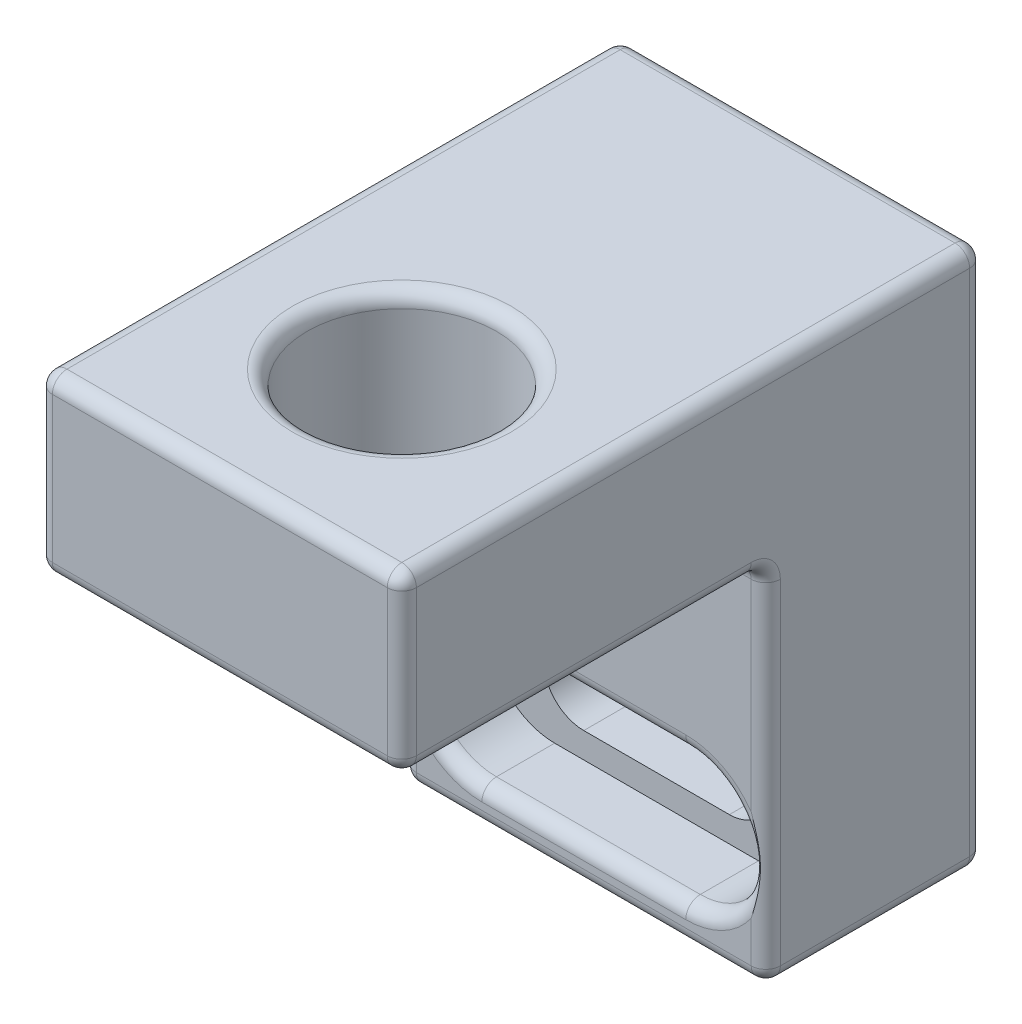
from build123d import *

# Parameters (mm, degrees)
CROQUIS1_W              = 25
CROQUIS1_H              = 37
SALIENTE_EXTRUIR1_DEPTH = 20
CROQUIS2_W              = 25
CROQUIS2_H              = 12
SALIENTE_EXTRUIR2_DEPTH = 20
CORTAR_EXTRUIR1_DEPTH   = 20
CORTAR_EXTRUIR2_DEPTH   = 10
CROQUIS5_R              = 6.5
CORTAR_EXTRUIR3_DEPTH   = 18
CROQUIS6_W              = 5
CROQUIS6_H              = 25
CORTAR_EXTRUIR4_DEPTH   = 28
REDONDEO1_R             = 1


with BuildPart() as part:
    # Croquis1 → Saliente-Extruir1 (new body)
    with BuildSketch(Plane.XY):
        Rectangle(CROQUIS1_W, CROQUIS1_H)
    extrude(amount=SALIENTE_EXTRUIR1_DEPTH)

    # Croquis2 → Saliente-Extruir2 (add)
    with BuildSketch(Plane.XY.offset(20)):
        with Locations((0, 12.5)):
            Rectangle(CROQUIS2_W, CROQUIS2_H)
    extrude(amount=SALIENTE_EXTRUIR2_DEPTH)

    # Croquis3 → Cortar-Extruir1 (cut)
    with BuildSketch(Plane.XY.offset(20)):
        with BuildLine():
            Line((-5, -8.75), (5, -8.75))
            ThreePointArc((5, -8.75), (7.75, -11.5), (5, -14.25))
            Line((5, -14.25), (-5, -14.25))
            ThreePointArc((-5, -14.25), (-7.75, -11.5), (-5, -8.75))
        make_face()
    extrude(amount=-CORTAR_EXTRUIR1_DEPTH, mode=Mode.SUBTRACT)

    # Croquis4 → Cortar-Extruir2 (cut)
    with BuildSketch(Plane.XY.offset(20)):
        with BuildLine():
            Line((-7, -7), (7, -7))
            ThreePointArc((7, -7), (11.5, -11.5), (7, -16))
            Line((7, -16), (-7, -16))
            ThreePointArc((-7, -16), (-11.5, -11.5), (-7, -7))
        make_face()
    extrude(amount=-CORTAR_EXTRUIR2_DEPTH, mode=Mode.SUBTRACT)

    # Croquis5 → Cortar-Extruir3 (cut)
    with BuildSketch(Plane(origin=(0, 18.5, 0), x_dir=(1, 0, 0), z_dir=(0, 1, 0))):
        with Locations(Location((0, -27.5, 0), (0, 0, 180))):
            Circle(CROQUIS5_R)
    extrude(amount=-CORTAR_EXTRUIR3_DEPTH, mode=Mode.SUBTRACT)

    # Croquis6 → Cortar-Extruir4 (cut)
    with BuildSketch(Plane(origin=(12.5, 0, 0), x_dir=(0, 0, -1), z_dir=(1, 0, 0))):
        with Locations((-17.5, -6)):
            Rectangle(CROQUIS6_W, CROQUIS6_H)
    extrude(amount=-CORTAR_EXTRUIR4_DEPTH, mode=Mode.SUBTRACT)

    # Redondeo1
    # the kernel refuses this fillet: 1 mm, written as the material it adds along each edge
    with BuildSketch(Plane(origin=(12.5, 6.5, 15), x_dir=(0, 0, 1), z_dir=(-1, 0, 0))) as redondeo1_piece_1:
        with BuildLine():
            CenterArc((REDONDEO1_R, -REDONDEO1_R), REDONDEO1_R, 90, 90)
            Line((0, -REDONDEO1_R), (0, 0))
            Line((0, 0), (REDONDEO1_R, 0))
        make_face()
    extrude(amount=25)
    # the kernel refuses this fillet: 1 mm, written as the material it takes off along each edge
    with BuildSketch(Plane(origin=(-11.5, 17.5, 39), x_dir=(0, 0, 1), z_dir=(0, 1, 0))) as redondeo1_2_piece_1_section:
        Polygon((0, 0), (REDONDEO1_R, 0), (REDONDEO1_R, -REDONDEO1_R), (0, -REDONDEO1_R), align=None)
    redondeo1_2_piece_1 = extrude(amount=REDONDEO1_R, mode=Mode.PRIVATE)
    redondeo1_2_piece_1 = redondeo1_2_piece_1 - Plane(origin=(-11.5, 17.5, 39), x_dir=(0.7071067811865475, 0, -0.7071067811865475), z_dir=(0, 1, 0)) * Sphere(REDONDEO1_R, mode=Mode.PRIVATE)
    add(redondeo1_2_piece_1, mode=Mode.SUBTRACT)
    with BuildSketch(Plane(origin=(11.5, 17.5, 39), x_dir=(1, 0, 0), z_dir=(0, 1, 0))) as redondeo1_2_piece_2_section:
        Polygon((0, 0), (REDONDEO1_R, 0), (REDONDEO1_R, -REDONDEO1_R), (0, -REDONDEO1_R), align=None)
    redondeo1_2_piece_2 = extrude(amount=REDONDEO1_R, mode=Mode.PRIVATE)
    redondeo1_2_piece_2 = redondeo1_2_piece_2 - Plane(origin=(11.5, 17.5, 39), x_dir=(-0.7071067811865475, 0, -0.7071067811865475), z_dir=(0, 1, 0)) * Sphere(REDONDEO1_R, mode=Mode.PRIVATE)
    add(redondeo1_2_piece_2, mode=Mode.SUBTRACT)
    with BuildSketch(Plane(origin=(11.5, 17.5, 1), x_dir=(1, 0, 0), z_dir=(0, 1, 0))) as redondeo1_2_piece_3_section:
        Polygon((0, 0), (REDONDEO1_R, 0), (REDONDEO1_R, REDONDEO1_R), (0, REDONDEO1_R), align=None)
    redondeo1_2_piece_3 = extrude(amount=REDONDEO1_R, mode=Mode.PRIVATE)
    redondeo1_2_piece_3 = redondeo1_2_piece_3 - Plane(origin=(11.5, 17.5, 1), x_dir=(-0.7071067811865475, 0, 0.7071067811865475), z_dir=(0, 1, 0)) * Sphere(REDONDEO1_R, mode=Mode.PRIVATE)
    add(redondeo1_2_piece_3, mode=Mode.SUBTRACT)
    with BuildSketch(Plane(origin=(-11.5, 17.5, 1), x_dir=(0, 0, -1), z_dir=(0, 1, 0))) as redondeo1_2_piece_4_section:
        Polygon((0, 0), (REDONDEO1_R, 0), (REDONDEO1_R, REDONDEO1_R), (0, REDONDEO1_R), align=None)
    redondeo1_2_piece_4 = extrude(amount=REDONDEO1_R, mode=Mode.PRIVATE)
    redondeo1_2_piece_4 = redondeo1_2_piece_4 - Plane(origin=(-11.5, 17.5, 1), x_dir=(0.7071067811865475, 0, 0.7071067811865475), z_dir=(0, 1, 0)) * Sphere(REDONDEO1_R, mode=Mode.PRIVATE)
    add(redondeo1_2_piece_4, mode=Mode.SUBTRACT)
    with BuildSketch(Plane(origin=(11.5, -17.5, 1), x_dir=(0, 0, -1), z_dir=(1, 0, 0))) as redondeo1_2_piece_5_section:
        Polygon((0, 0), (REDONDEO1_R, 0), (REDONDEO1_R, -REDONDEO1_R), (0, -REDONDEO1_R), align=None)
    redondeo1_2_piece_5 = extrude(amount=REDONDEO1_R, mode=Mode.PRIVATE)
    redondeo1_2_piece_5 = redondeo1_2_piece_5 - Plane(origin=(11.5, -17.5, 1), x_dir=(0, 0.7071067811865475, 0.7071067811865475), z_dir=(1, 0, 0)) * Sphere(REDONDEO1_R, mode=Mode.PRIVATE)
    add(redondeo1_2_piece_5, mode=Mode.SUBTRACT)
    with BuildSketch(Plane(origin=(-11.5, -17.5, 1), x_dir=(-1, 0, 0), z_dir=(0, 0, -1))) as redondeo1_2_piece_6_section:
        Polygon((0, 0), (REDONDEO1_R, 0), (REDONDEO1_R, -REDONDEO1_R), (0, -REDONDEO1_R), align=None)
    redondeo1_2_piece_6 = extrude(amount=REDONDEO1_R, mode=Mode.PRIVATE)
    redondeo1_2_piece_6 = redondeo1_2_piece_6 - Plane(origin=(-11.5, -17.5, 1), x_dir=(0.7071067811865474, 0.7071067811865477, 0), z_dir=(0, 0, -1)) * Sphere(REDONDEO1_R, mode=Mode.PRIVATE)
    add(redondeo1_2_piece_6, mode=Mode.SUBTRACT)
    with BuildSketch(Plane(origin=(-12.5, 4, 40), x_dir=(1, 0, 0), z_dir=(0, 1, 0))) as redondeo1_2_piece_7:
        with BuildLine():
            CenterArc((REDONDEO1_R, REDONDEO1_R), REDONDEO1_R, 180, 90)
            Line((0, REDONDEO1_R), (0, 0))
            Line((0, 0), (REDONDEO1_R, 0))
        make_face()
    extrude(amount=13.5, mode=Mode.SUBTRACT)
    with BuildSketch(Plane(origin=(15, 6.5, 40), x_dir=(0, 1, 0), z_dir=(-1, 0, 0))) as redondeo1_2_piece_8:
        with BuildLine():
            CenterArc((REDONDEO1_R, REDONDEO1_R), REDONDEO1_R, 180, 90)
            Line((0, REDONDEO1_R), (0, 0))
            Line((0, 0), (REDONDEO1_R, 0))
        make_face()
    extrude(amount=30, mode=Mode.SUBTRACT)
    with BuildSketch(Plane(origin=(12.5, 17.5, 40), x_dir=(0, 0, -1), z_dir=(0, -1, 0))) as redondeo1_2_piece_9:
        with BuildLine():
            CenterArc((REDONDEO1_R, -REDONDEO1_R), REDONDEO1_R, 90, 90)
            Line((0, -REDONDEO1_R), (0, 0))
            Line((0, 0), (REDONDEO1_R, 0))
        make_face()
    extrude(amount=13.5, mode=Mode.SUBTRACT)
    with BuildSketch(Plane(origin=(-11.5, 18.5, 40), x_dir=(0, 0, -1), z_dir=(1, 0, 0)), Plane(origin=(11.5, 18.5, 0), x_dir=(0, 0, 1), z_dir=(-1, 0, 0))) as redondeo1_2_piece_10:
        with BuildLine():
            CenterArc((REDONDEO1_R, -REDONDEO1_R), REDONDEO1_R, 90, 90)
            Line((0, -REDONDEO1_R), (0, 0))
            Line((0, 0), (REDONDEO1_R, 0))
        make_face()
    extrude(amount=23, mode=Mode.SUBTRACT)
    with BuildSketch(Plane(origin=(12.5, -17.5, 0), x_dir=(0, 0, 1), z_dir=(0, 1, 0))) as redondeo1_2_piece_11:
        with BuildLine():
            CenterArc((REDONDEO1_R, -REDONDEO1_R), REDONDEO1_R, 90, 90)
            Line((0, -REDONDEO1_R), (0, 0))
            Line((0, 0), (REDONDEO1_R, 0))
        make_face()
    extrude(amount=35, mode=Mode.SUBTRACT)
    with BuildSketch(Plane(origin=(-11.5, -18.5, 0), x_dir=(0, 1, 0), z_dir=(1, 0, 0))) as redondeo1_2_piece_12:
        with BuildLine():
            CenterArc((REDONDEO1_R, REDONDEO1_R), REDONDEO1_R, 180, 90)
            Line((0, REDONDEO1_R), (0, 0))
            Line((0, 0), (REDONDEO1_R, 0))
        make_face()
    extrude(amount=23, mode=Mode.SUBTRACT)
    with BuildSketch(Plane(origin=(-12.5, 17.5, 0), x_dir=(1, 0, 0), z_dir=(0, -1, 0))) as redondeo1_2_piece_13:
        with BuildLine():
            CenterArc((REDONDEO1_R, REDONDEO1_R), REDONDEO1_R, 180, 90)
            Line((0, REDONDEO1_R), (0, 0))
            Line((0, 0), (REDONDEO1_R, 0))
        make_face()
    extrude(amount=35, mode=Mode.SUBTRACT)
    with BuildSketch(Plane(origin=(0, 6.5, 27.5), x_dir=(-1, 0, 0), z_dir=(0, 0, -1))) as redondeo1_2_piece_14:
        with BuildLine():
            CenterArc((6.5 + REDONDEO1_R, REDONDEO1_R), REDONDEO1_R, 180, 90)
            Line((6.5 + REDONDEO1_R, 0), (6.5, 0))
            Line((6.5, 0), (6.5, REDONDEO1_R))
        make_face()
    revolve(axis=Axis((0, 6.5, 27.5), (0, 1, 0)), mode=Mode.SUBTRACT)
    with BuildSketch(Plane(origin=(0, 18.5, 27.5), x_dir=(-1, 0, 0), z_dir=(0, 0, -1))) as redondeo1_2_piece_15:
        with BuildLine():
            CenterArc((6.5 + REDONDEO1_R, -REDONDEO1_R), REDONDEO1_R, 90, 90)
            Line((6.5, -REDONDEO1_R), (6.5, 0))
            Line((6.5, 0), (6.5 + REDONDEO1_R, 0))
        make_face()
    revolve(axis=Axis((0, 18.5, 27.5), (0, 1, 0)), mode=Mode.SUBTRACT)
    with BuildSketch(Plane(origin=(-12.5, 18.5, 1), x_dir=(1, 0, 0), z_dir=(0, 0, 1)), Plane(origin=(12.5, 18.5, 39), x_dir=(-1, 0, 0), z_dir=(0, 0, -1))) as redondeo1_2_piece_16:
        with BuildLine():
            CenterArc((REDONDEO1_R, -REDONDEO1_R), REDONDEO1_R, 90, 90)
            Line((0, -REDONDEO1_R), (0, 0))
            Line((0, 0), (REDONDEO1_R, 0))
        make_face()
    extrude(amount=38, mode=Mode.SUBTRACT)
    with BuildSketch(Plane(origin=(-7, -16, 15), x_dir=(0, -1, 0), z_dir=(1, 0, 0)), Plane(origin=(7, -7, 15), x_dir=(0, 1, 0), z_dir=(-1, 0, 0))) as redondeo1_2_piece_17:
        with BuildLine():
            CenterArc((REDONDEO1_R, REDONDEO1_R), REDONDEO1_R, 180, 90)
            Line((0, REDONDEO1_R), (0, 0))
            Line((0, 0), (REDONDEO1_R, 0))
        make_face()
    extrude(amount=14, mode=Mode.SUBTRACT)
    with BuildSketch(Plane(origin=(12.5, -18.5, 1), x_dir=(0, 1, 0), z_dir=(0, 0, 1))) as redondeo1_2_piece_18:
        with BuildLine():
            CenterArc((REDONDEO1_R, REDONDEO1_R), REDONDEO1_R, 180, 90)
            Line((0, REDONDEO1_R), (0, 0))
            Line((0, 0), (REDONDEO1_R, 0))
        make_face()
    extrude(amount=16.5, mode=Mode.SUBTRACT)
    with BuildSketch(Plane(origin=(-12.5, -18.5, 1), x_dir=(0, 1, 0), z_dir=(0, 0, 1))) as redondeo1_2_piece_19:
        with BuildLine():
            CenterArc((REDONDEO1_R, -REDONDEO1_R), REDONDEO1_R, 90, 90)
            Line((0, -REDONDEO1_R), (0, 0))
            Line((0, 0), (REDONDEO1_R, 0))
        make_face()
    extrude(amount=16.5, mode=Mode.SUBTRACT)
    with BuildSketch(Plane(origin=(15, -18.5, 15), x_dir=(0, 0, -1), z_dir=(-1, 0, 0))) as redondeo1_2_piece_20:
        with BuildLine():
            CenterArc((REDONDEO1_R, -REDONDEO1_R), REDONDEO1_R, 90, 90)
            Line((0, -REDONDEO1_R), (0, 0))
            Line((0, 0), (REDONDEO1_R, 0))
        make_face()
    extrude(amount=30, mode=Mode.SUBTRACT)
    with BuildSketch(Plane(origin=(-7, -11.5, 15), x_dir=(0, 1, 0), z_dir=(1, 0, 0))) as redondeo1_2_piece_21:
        with BuildLine():
            CenterArc((4.5 + REDONDEO1_R, -REDONDEO1_R), REDONDEO1_R, 90, 90)
            Line((4.5, -REDONDEO1_R), (4.5, 0))
            Line((4.5, 0), (4.5 + REDONDEO1_R, 0))
        make_face()
    revolve(axis=Axis((-7, -11.5, 15), (0, 0, 1)), revolution_arc=180, mode=Mode.SUBTRACT)
    with BuildSketch(Plane(origin=(7, -11.5, 15), x_dir=(0, -1, 0), z_dir=(-1, 0, 0))) as redondeo1_2_piece_22:
        with BuildLine():
            CenterArc((4.5 + REDONDEO1_R, -REDONDEO1_R), REDONDEO1_R, 90, 90)
            Line((4.5, -REDONDEO1_R), (4.5, 0))
            Line((4.5, 0), (4.5 + REDONDEO1_R, 0))
        make_face()
    revolve(axis=Axis((7, -11.5, 15), (0, 0, 1)), revolution_arc=180, mode=Mode.SUBTRACT)
    # the kernel refuses this fillet: 1 mm, written as the material it takes off along each edge
    with BuildSketch(Plane(origin=(11.5, -17.5, 14), x_dir=(0, 0, 1), z_dir=(1, 0, 0))) as redondeo1_3_piece_1_section:
        Polygon((0, 0), (REDONDEO1_R, 0), (REDONDEO1_R, REDONDEO1_R), (0, REDONDEO1_R), align=None)
    redondeo1_3_piece_1 = extrude(amount=REDONDEO1_R, mode=Mode.PRIVATE)
    redondeo1_3_piece_1 = redondeo1_3_piece_1 - Plane(origin=(11.5, -17.5, 14), x_dir=(0, 0.7071067811865475, -0.7071067811865475), z_dir=(1, 0, 0)) * Sphere(REDONDEO1_R, mode=Mode.PRIVATE)
    add(redondeo1_3_piece_1, mode=Mode.SUBTRACT)
    with BuildSketch(Plane(origin=(-11.5, -17.5, 14), x_dir=(0, 0, 1), z_dir=(-1, 0, 0))) as redondeo1_3_piece_2_section:
        Polygon((0, 0), (REDONDEO1_R, 0), (REDONDEO1_R, -REDONDEO1_R), (0, -REDONDEO1_R), align=None)
    redondeo1_3_piece_2 = extrude(amount=REDONDEO1_R, mode=Mode.PRIVATE)
    redondeo1_3_piece_2 = redondeo1_3_piece_2 - Plane(origin=(-11.5, -17.5, 14), x_dir=(0, 0.7071067811865475, -0.7071067811865475), z_dir=(-1, 0, 0)) * Sphere(REDONDEO1_R, mode=Mode.PRIVATE)
    add(redondeo1_3_piece_2, mode=Mode.SUBTRACT)
    with BuildSketch(Plane(origin=(11.5, 7.5, 39), x_dir=(0, -1, 0), z_dir=(1, 0, 0))) as redondeo1_3_piece_3_section:
        Polygon((0, 0), (REDONDEO1_R, 0), (REDONDEO1_R, -REDONDEO1_R), (0, -REDONDEO1_R), align=None)
    redondeo1_3_piece_3 = extrude(amount=REDONDEO1_R, mode=Mode.PRIVATE)
    redondeo1_3_piece_3 = redondeo1_3_piece_3 - Plane(origin=(11.5, 7.5, 39), x_dir=(0, 0.7071067811865475, -0.7071067811865475), z_dir=(1, 0, 0)) * Sphere(REDONDEO1_R, mode=Mode.PRIVATE)
    add(redondeo1_3_piece_3, mode=Mode.SUBTRACT)
    with BuildSketch(Plane(origin=(-11.5, 7.5, 39), x_dir=(0, -1, 0), z_dir=(-1, 0, 0))) as redondeo1_3_piece_4_section:
        Polygon((0, 0), (REDONDEO1_R, 0), (REDONDEO1_R, REDONDEO1_R), (0, REDONDEO1_R), align=None)
    redondeo1_3_piece_4 = extrude(amount=REDONDEO1_R, mode=Mode.PRIVATE)
    redondeo1_3_piece_4 = redondeo1_3_piece_4 - Plane(origin=(-11.5, 7.5, 39), x_dir=(0, 0.7071067811865475, -0.7071067811865475), z_dir=(-1, 0, 0)) * Sphere(REDONDEO1_R, mode=Mode.PRIVATE)
    add(redondeo1_3_piece_4, mode=Mode.SUBTRACT)
    with BuildSketch(Plane(origin=(-12.5, 6.5, 16), x_dir=(0, 1, 0), z_dir=(0, 0, 1)), Plane(origin=(12.5, 6.5, 39), x_dir=(0, 1, 0), z_dir=(0, 0, -1))) as redondeo1_3_piece_5:
        with BuildLine():
            CenterArc((REDONDEO1_R, -REDONDEO1_R), REDONDEO1_R, 90, 90)
            Line((0, -REDONDEO1_R), (0, 0))
            Line((0, 0), (REDONDEO1_R, 0))
        make_face()
    extrude(amount=23, mode=Mode.SUBTRACT)
    with BuildSketch(Plane(origin=(-12.5, -11.499999979, 15), x_dir=(0, 0, -1), z_dir=(0, -1, 0))) as redondeo1_3_piece_6:
        with BuildLine():
            CenterArc((REDONDEO1_R, REDONDEO1_R), REDONDEO1_R, 180, 90)
            Line((0, REDONDEO1_R), (0, 0))
            Line((0, 0), (REDONDEO1_R, 0))
        make_face()
    extrude(amount=6.000000021, mode=Mode.SUBTRACT)
    with BuildSketch(Plane(origin=(-12.5, 5.5, 15), x_dir=(0, 0, -1), z_dir=(0, -1, 0))) as redondeo1_3_piece_7:
        with BuildLine():
            CenterArc((REDONDEO1_R, REDONDEO1_R), REDONDEO1_R, 180, 90)
            Line((0, REDONDEO1_R), (0, 0))
            Line((0, 0), (REDONDEO1_R, 0))
        make_face()
    extrude(amount=16.999999979, mode=Mode.SUBTRACT)
    with BuildSketch(Plane(origin=(12.5, 5.5, 15), x_dir=(0, 0, -1), z_dir=(0, -1, 0))) as redondeo1_3_piece_8:
        with BuildLine():
            CenterArc((REDONDEO1_R, -REDONDEO1_R), REDONDEO1_R, 90, 90)
            Line((0, -REDONDEO1_R), (0, 0))
            Line((0, 0), (REDONDEO1_R, 0))
        make_face()
    extrude(amount=16.999999981, mode=Mode.SUBTRACT)
    with BuildSketch(Plane(origin=(12.5, -11.499999981, 15), x_dir=(0, 0, -1), z_dir=(0, -1, 0))) as redondeo1_3_piece_9:
        with BuildLine():
            CenterArc((REDONDEO1_R, -REDONDEO1_R), REDONDEO1_R, 90, 90)
            Line((0, -REDONDEO1_R), (0, 0))
            Line((0, 0), (REDONDEO1_R, 0))
        make_face()
    extrude(amount=6.000000019, mode=Mode.SUBTRACT)
    with BuildSketch(Plane(origin=(12.5, 5.5, 16), x_dir=(0, 1, 0), z_dir=(0, 0, 1))) as redondeo1_3_piece_10:
        with BuildLine():
            CenterArc((1 + REDONDEO1_R, REDONDEO1_R), REDONDEO1_R, 180, 90)
            Line((1, REDONDEO1_R), (1, 0))
            Line((1, 0), (1 + REDONDEO1_R, 0))
        make_face()
    revolve(axis=Axis((12.5, 5.5, 16), (-1, 0, 0)), revolution_arc=90, mode=Mode.SUBTRACT)
    with BuildSketch(Plane(origin=(-12.5, 5.5, 16), x_dir=(0, 1, 0), z_dir=(0, 0, 1))) as redondeo1_3_piece_11:
        with BuildLine():
            CenterArc((1 + REDONDEO1_R, -REDONDEO1_R), REDONDEO1_R, 90, 90)
            Line((1, -REDONDEO1_R), (1, 0))
            Line((1, 0), (1 + REDONDEO1_R, 0))
        make_face()
    revolve(axis=Axis((-12.5, 5.5, 16), (-1, 0, 0)), revolution_arc=90, mode=Mode.SUBTRACT)


solid = part.part
